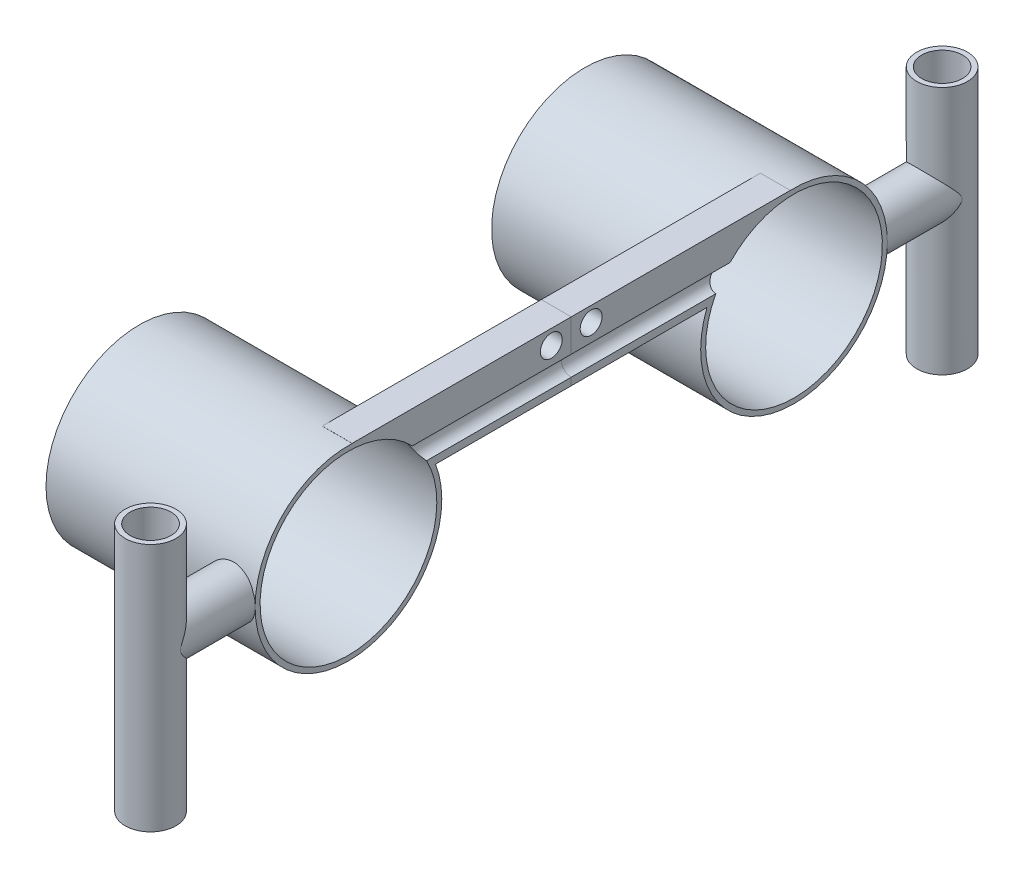
from build123d import *

# Parameters (mm, degrees)
SKETCH1_R                = 18.75
SKETCH1_R_2              = 17.75
BOSS_EXTRUDE1_DEPTH      = 40
BOSS_EXTRUDE2_START      = 2
SKETCH2_R                = 18.75
SKETCH2_R_2              = 10
BOSS_EXTRUDE2_DEPTH      = 2
BOSS_EXTRUDE4_START      = 17.75
BOSS_EXTRUDE4_OUTLINE_R  = 5
BOSS_EXTRUDE4_DEPTH      = 16
BOSS_EXTRUDE5_DEPTH      = 15
BOSS_EXTRUDE5_DEPTH_BACK = 35
SKETCH8_R                = 5.1
SKETCH8_R_2              = 4.1
SKETCH9_R                = 4.1
CUT_EXTRUDE1_DEPTH       = 32
BOSS_EXTRUDE6_DEPTH      = 26
BOSS_EXTRUDE6_DEPTH_BACK = 18
CUT_EXTRUDE2_START       = -26
SKETCH12_R               = 17.75
CUT_EXTRUDE2_DEPTH       = 26
SKETCH14_R               = 2.2
CUT_EXTRUDE4_DEPTH       = 5
SKETCH15_R               = 2
CUT_EXTRUDE5_DEPTH       = 34.5


# Read off the part's stored shape, not the designer's step: Boss-Extrude4
with BuildPart() as part:
    # Sketch1 → Boss-Extrude1 (new body)
    with BuildSketch(Plane.YZ):
        with Locations(Location((0, 0, 0), (0, 0, 270))):
            Circle(SKETCH1_R)
        with Locations(Location((0, 0, 0), (0, 0, 270))):
            Circle(SKETCH1_R_2, mode=Mode.SUBTRACT)
    extrude(amount=BOSS_EXTRUDE1_DEPTH)

    # Sketch2 → Boss-Extrude2 (add)
    with BuildSketch(Plane(origin=(0, 0, 0), x_dir=(0, -1, 0), z_dir=(-1, 0, 0)).offset(BOSS_EXTRUDE2_START)):
        with Locations(Location((0, 0, 0), (0, 0, 90))):
            Circle(SKETCH2_R)
        with Locations(Location((0, 0, 0), (0, 0, 90))):
            Circle(SKETCH2_R_2, mode=Mode.SUBTRACT)
    extrude(amount=-BOSS_EXTRUDE2_DEPTH)

    # Sketch11 → Boss-Extrude6 (add, two sides: drawn at the far end of the back side and taken through both)
    with BuildSketch(Plane.YX.offset(18.75).offset(-BOSS_EXTRUDE6_DEPTH_BACK)):
        with BuildLine():
            Line((6.75, 40), (18.75, 40))
            Line((18.75, 40), (18.75, 34))
            Line((18.75, 34), (12.75, 34))
            ThreePointArc((12.75, 34), (8.507359313, 35.757359313), (6.75, 40))
        make_face()
    extrude(amount=BOSS_EXTRUDE6_DEPTH + BOSS_EXTRUDE6_DEPTH_BACK)

    # Sketch12 → Cut-Extrude2 (cut)
    with BuildSketch(Plane.YZ.offset(40).offset(CUT_EXTRUDE2_START)):
        with Locations(Location((0, 0, 0), (0, 0, 270))):
            Circle(SKETCH12_R)
    extrude(amount=CUT_EXTRUDE2_DEPTH, mode=Mode.SUBTRACT)

    # Sketch14 → Cut-Extrude4 (cut)
    with BuildSketch(Plane.YZ.offset(40)):
        with Locations(Location((15.75, -40.75, 0), (0, 0, 270))):
            Circle(SKETCH14_R)
    extrude(amount=-CUT_EXTRUDE4_DEPTH, mode=Mode.SUBTRACT)

    # Sketch15 → Cut-Extrude5 (cut)
    with BuildSketch(Plane(origin=(0, 0, -44.75), x_dir=(1, 0, 0), z_dir=(0, 0, -1))):
        with Locations((40, -10.25)):
            Circle(SKETCH15_R)
    extrude(amount=-CUT_EXTRUDE5_DEPTH, mode=Mode.SUBTRACT)


with BuildPart() as body_2:
    # Boss-Extrude4 outline → Boss-Extrude4 (new body)
    with BuildSketch(Plane.XY.offset(BOSS_EXTRUDE4_START)):
        with Locations((35, 0)):
            Circle(BOSS_EXTRUDE4_OUTLINE_R)
    extrude(amount=BOSS_EXTRUDE4_DEPTH)

    # Sketch8 → Boss-Extrude5 (add, two sides: drawn at the far end of the back side and taken through both)
    with BuildSketch(Plane(origin=(0, 5, 0), x_dir=(-1, 0, 0), z_dir=(0, 1, 0)).offset(-BOSS_EXTRUDE5_DEPTH_BACK)):
        with Locations(Location((-35, 34.75, 0), (0, 0, 90))):
            Circle(SKETCH8_R)
        with Locations(Location((-35, 34.75, 0), (0, 0, 90))):
            Circle(SKETCH8_R_2, mode=Mode.SUBTRACT)
    extrude(amount=BOSS_EXTRUDE5_DEPTH + BOSS_EXTRUDE5_DEPTH_BACK)

    # Sketch9 → Cut-Extrude1 (cut)
    with BuildSketch(Plane(origin=(0, 20, 0), x_dir=(-1, 0, 0), z_dir=(0, 1, 0))):
        with Locations(Location((-35, 34.75, 0), (0, 0, 90))):
            Circle(SKETCH9_R)
    extrude(amount=-CUT_EXTRUDE1_DEPTH, mode=Mode.SUBTRACT)


with BuildPart() as body_3:
    # Mirror1: mirrored copy
    add(part.part.mirror(Plane(origin=(0, 0, -44.75), x_dir=(1, 0, 0), z_dir=(0, 0, -1))))


with BuildPart() as body_4:
    # Mirror1 2: mirrored copy
    add(body_2.part.mirror(Plane(origin=(0, 0, -44.75), x_dir=(1, 0, 0), z_dir=(0, 0, -1))))


solid = Compound([part.part, body_2.part, body_3.part, body_4.part])
